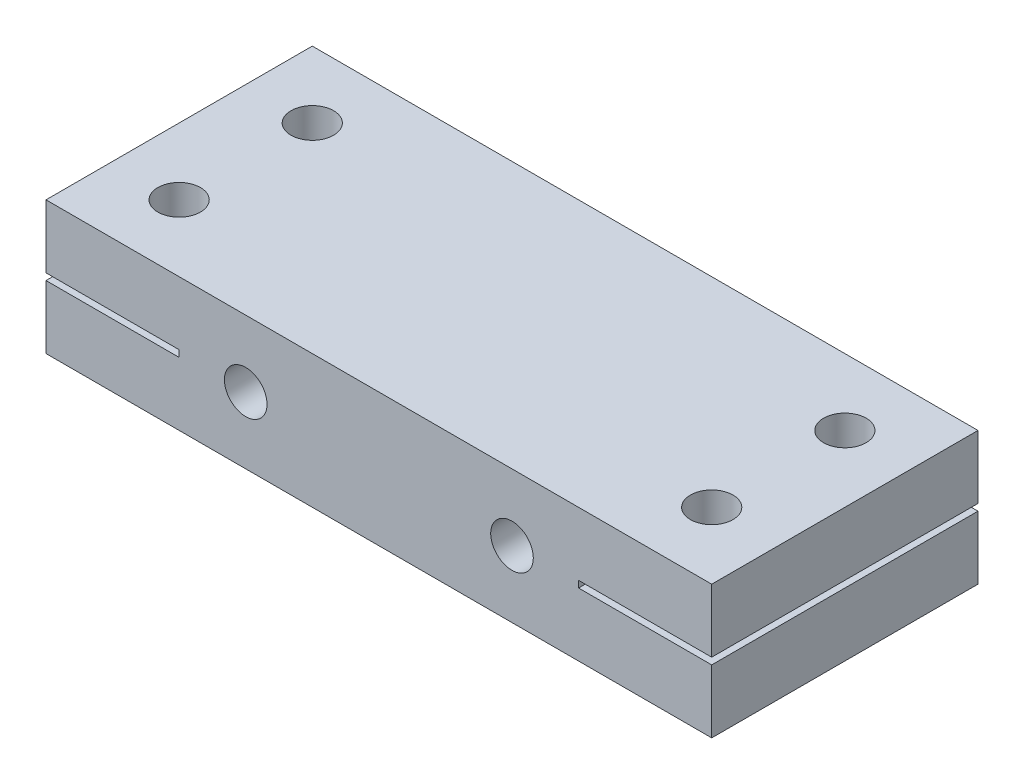
from build123d import *

# Parameters (mm, degrees)
SKETCH1_W           = 50
SKETCH1_H           = 10
BOSS_EXTRUDE1_DEPTH = 10
SKETCH2_W           = 10
SKETCH2_H           = 0.5
CUT_EXTRUDE1_DEPTH  = 55.083269132
SKETCH3_R           = 1.6
CUT_EXTRUDE2_DEPTH  = 52.961524227
SKETCH5_R           = 1.6
CUT_EXTRUDE3_DEPTH  = 55.083269132


with BuildPart() as part:
    # Sketch1 → Boss-Extrude1 (new, symmetric)
    with BuildSketch(Plane.XY):
        with Locations((25, 0)):
            Rectangle(SKETCH1_W, SKETCH1_H)
    extrude(amount=BOSS_EXTRUDE1_DEPTH, both=True)

    # Sketch2 → Cut-Extrude1 (cut, through all)
    with BuildSketch(Plane.XY.offset(10)):
        with Locations((5, 0)):
            Rectangle(SKETCH2_W, SKETCH2_H)
        with Locations((45, 0)):
            Rectangle(SKETCH2_W, SKETCH2_H)
    extrude(amount=-CUT_EXTRUDE1_DEPTH, mode=Mode.SUBTRACT)

    # Sketch3 → Cut-Extrude2 (cut, through all)
    with BuildSketch(Plane(origin=(0, 5, 0), x_dir=(1, 0, 0), z_dir=(0, 1, 0))):
        with Locations((5, 5)):
            Circle(SKETCH3_R)
        with Locations((45, 5)):
            Circle(SKETCH3_R)
        with Locations((5, -5)):
            Circle(SKETCH3_R)
        with Locations((45, -5)):
            Circle(SKETCH3_R)
    extrude(amount=-CUT_EXTRUDE2_DEPTH, mode=Mode.SUBTRACT)

    # Sketch5 → Cut-Extrude3 (cut, through all)
    with BuildSketch(Plane.XY.offset(10)):
        with Locations((15, 0)):
            Circle(SKETCH5_R)
        with Locations((35, 0)):
            Circle(SKETCH5_R)
    extrude(amount=-CUT_EXTRUDE3_DEPTH, mode=Mode.SUBTRACT)


solid = part.part
